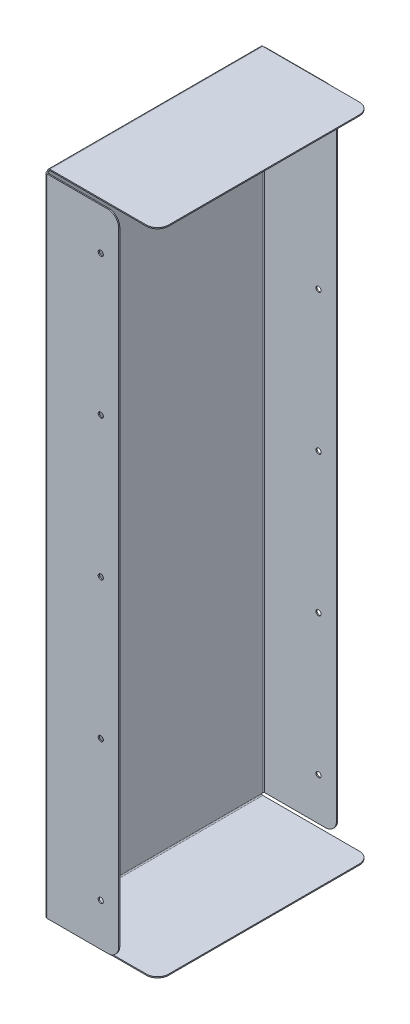
from build123d import *

# Parameters (mm, degrees)
BASE_FLANGE1_DEPTH           = 144
EDGE_FLANGE1_DEPTH           = 872
EDGE_FLANGE1_BEND_DEPTH      = 872
F_7_0_7_DIAMETER_HOLE1_D     = 7
F_7_0_7_DIAMETER_HOLE1_DEPTH = 1.5
FILLET1_R                    = 15
CUT_EXTRUDE1_DEPTH           = 487.946095579


# Sheet-metal steps are written as plain solids
with BuildPart() as part:
    # Sketch1 → Base-Flange1 (new, symmetric)
    with BuildSketch(Plane.XY):
        with BuildLine():
            Line((147, 438), (1.5, 438))
            ThreePointArc((1.5, 438), (0.439339828, 437.560660172), (0, 436.5))
            Line((0, 436.5), (0, -436.5))
            ThreePointArc((0, -436.5), (0.439339828, -437.560660172), (1.5, -438))
            Line((1.5, -438), (147, -438))
            Line((147, -438), (147, -439.5))
            Line((147, -439.5), (1.5, -439.5))
            ThreePointArc((1.5, -439.5), (-0.621320344, -438.621320344), (-1.5, -436.5))
            Line((-1.5, -436.5), (-1.5, 436.5))
            ThreePointArc((-1.5, 436.5), (-0.621320344, 438.621320344), (1.5, 439.5))
            Line((1.5, 439.5), (147, 439.5))
            Line((147, 439.5), (147, 438))
        make_face()
    extrude(amount=BASE_FLANGE1_DEPTH, both=True)

    # Edge-Flange1 section (across the edge) → Edge-Flange1 (add)
    with BuildSketch(Plane(origin=(0, 436, 146.5), x_dir=(0, 0, -1), z_dir=(0, -1, 0))):
        with BuildLine():
            Line((-1.5, 1.5), (-1.5, 98.5))
            Line((-1.5, 98.5), (0, 98.5))
            Line((0, 98.5), (0, 1.5))
            ThreePointArc((0, 1.5), (0.439339828, 0.439339828), (1.5, 0))
            Line((1.5, 0), (2.5, 0))
            Line((2.5, 0), (2.5, -1.5))
            Line((2.5, -1.5), (1.5, -1.5))
            ThreePointArc((1.5, -1.5), (-0.621320344, -0.621320344), (-1.5, 1.5))
        make_face()
    extrude(amount=EDGE_FLANGE1_DEPTH)

    # Edge-Flange1 section 2 (across the edge) → Edge-Flange1 bend (add)
    with BuildSketch(Plane(origin=(0, -436, -146.5), x_dir=(0, 0, 1), z_dir=(0, 1, 0))):
        with BuildLine():
            Line((-1.5, 1.5), (-1.5, 98.5))
            Line((-1.5, 98.5), (0, 98.5))
            Line((0, 98.5), (0, 1.5))
            ThreePointArc((0, 1.5), (0.439339828, 0.439339828), (1.5, 0))
            Line((1.5, 0), (2.5, 0))
            Line((2.5, 0), (2.5, -1.5))
            Line((2.5, -1.5), (1.5, -1.5))
            ThreePointArc((1.5, -1.5), (-0.621320344, -0.621320344), (-1.5, 1.5))
        make_face()
    extrude(amount=EDGE_FLANGE1_BEND_DEPTH)

    # Ø7.0 (7) Diameter Hole1
    with Locations(Plane(origin=(0, 0, 146.5), x_dir=(-1, 0, 0), z_dir=(0, 0, -1))):
        with Locations((-74.25, 379.5), (-74.25, 190), (-74.25, 0.5), (-74.25, -189), (-74.25, -378.5)):
            f_7_0_7_diameter_hole1 = Hole(F_7_0_7_DIAMETER_HOLE1_D / 2, depth=F_7_0_7_DIAMETER_HOLE1_DEPTH)

    # Mirror1: Ø7.0 (7) Diameter Hole1 across plane
    add(f_7_0_7_diameter_hole1.mirror(Plane.XY), mode=Mode.SUBTRACT)

    # Fillet1
    fillet1_edges = [part.edges().sort_by_distance(p)[0] for p in [
        (147, 438.75, -144),
        (147, -438.75, -144),
        (147, 438.75, 144),
        (98.5, 436, 147.25),
        (98.5, -436, 147.25),
        (98.5, -436, -147.25),
        (98.5, 436, -147.25),
        (147, -438.75, 144),
    ]]
    fillet(fillet1_edges, radius=FILLET1_R)

    # Sketch14 → Cut-Extrude1 (cut, through all)
    with BuildSketch(Plane.ZY.offset(1.5)):
        with BuildLine():
            Line((80.5, -392.778719262), (80.5, -386.221280738))
            ThreePointArc((80.5, -386.221280738), (70, -378.5), (59.5, -386.221280738))
            Line((59.5, -386.221280738), (59.5, -392.778719262))
            ThreePointArc((59.5, -392.778719262), (70, -400.5), (80.5, -392.778719262))
        make_face()
    extrude(amount=-CUT_EXTRUDE1_DEPTH, mode=Mode.SUBTRACT)


solid = part.part
